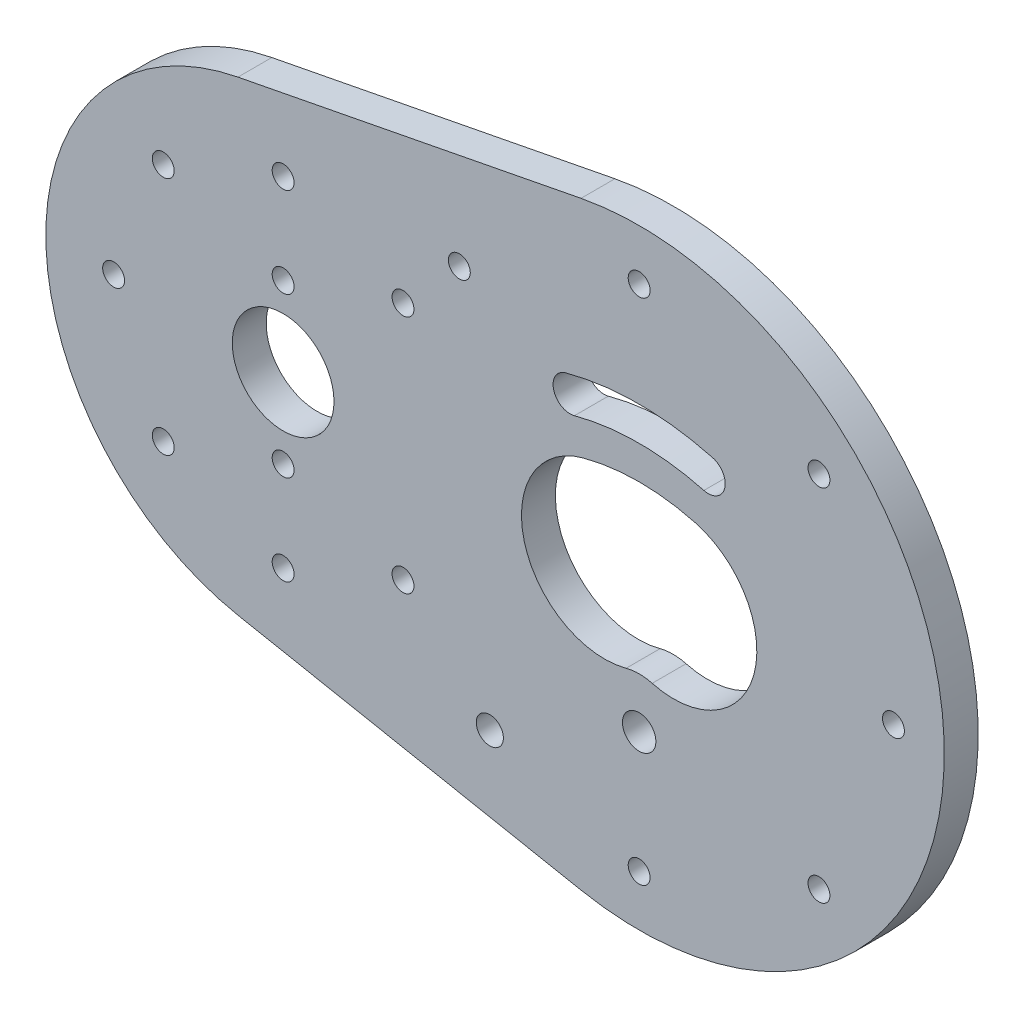
from build123d import *

# Parameters (mm, degrees)
SKETCH1_W                    = 127
SKETCH1_H                    = 88.9
SKETCH1_R                    = 1.564880276
SKETCH1_R_2                  = 4.7625
BOSS_EXTRUDE1_DEPTH          = 3.175
SKETCH2_W                    = 177.519600035
SKETCH2_H                    = 126.718171086
CUT_EXTRUDE1_DEPTH           = 108.848817398
SKETCH4_R                    = 0.635
SKETCH4_R_2                  = 1.27
CUT_EXTRUDE2_DEPTH           = 70.169557294
SKETCH5_R                    = 0.635
CUT_EXTRUDE3_DEPTH           = 70.169557294
M2_5X0_45_TAPPED_HOLE2_D     = 2.05
M2_5X0_45_TAPPED_HOLE2_DEPTH = 7.366
M2_5X0_45_TAPPED_HOLE2_TIP   = 0.615882135


with BuildPart() as part:
    # Sketch1 → Boss-Extrude1 (new body)
    with BuildSketch(Plane.XY):
        with Locations((-28.03132955, 12.5)):
            Rectangle(SKETCH1_W, SKETCH1_H)
        Circle(SKETCH1_R, mode=Mode.SUBTRACT)
        with Locations((-33.3375, 12.5)):
            Circle(SKETCH1_R_2, mode=Mode.SUBTRACT)
        with BuildLine():
            ThreePointArc((5.250170212, 19.593901979), (10.755067214, 10.059140681), (1.220305916, 4.554243678))
            ThreePointArc((1.220305916, 4.554243678), (0, 4.7149), (-1.220305916, 4.554243678))
            ThreePointArc((-1.220305916, 4.554243678), (-10.755067214, 10.059140681), (-5.250170212, 19.593901979))
            ThreePointArc((-5.250170212, 19.593901979), (0, 20.2851), (5.250170212, 19.593901979))
        make_face(mode=Mode.SUBTRACT)
        with BuildLine():
            ThreePointArc((6.881351362, 25.681552906), (0, 26.5875), (-6.881351362, 25.681552906))
            ThreePointArc((-6.881351362, 25.681552906), (-8.003883377, 23.737270423), (-6.059600893, 22.614738408))
            ThreePointArc((-6.059600893, 22.614738408), (0, 23.4125), (6.059600893, 22.614738408))
            ThreePointArc((6.059600893, 22.614738408), (8.003883377, 23.737270423), (6.881351362, 25.681552906))
        make_face(mode=Mode.SUBTRACT)
    extrude(amount=BOSS_EXTRUDE1_DEPTH)

    # Sketch2 → Cut-Extrude1 (cut, through all)
    with BuildSketch(Plane.XY.offset(3.175)):
        with Locations((-18.257651528, 17.008273159)):
            Rectangle(SKETCH2_W, SKETCH2_H)
        with BuildLine():
            Line((-37.570833333, 34.318100602), (-5.442857143, 40.551843631))
            ThreePointArc((-5.442857143, 40.551843631), (28.575, 12.5), (-5.442857143, -15.551843631))
            Line((-5.442857143, -15.551843631), (-37.570833333, -9.318100602))
            ThreePointArc((-37.570833333, -9.318100602), (-55.5625, 12.5), (-37.570833333, 34.318100602))
        make_face(mode=Mode.SUBTRACT)
    extrude(amount=-CUT_EXTRUDE1_DEPTH, mode=Mode.SUBTRACT)

    # Sketch4 → Cut-Extrude2 (cut, through all)
    with BuildSketch(Plane.XY.offset(3.175)):
        with Locations((-33.3375, 28.375)):
            Circle(SKETCH4_R)
        with Locations((0, 36.3125)):
            Circle(SKETCH4_R)
        with Locations((-22.112179849, 23.725320151)):
            Circle(SKETCH4_R)
        with Locations((-13.982083803, -6.855416197)):
            Circle(SKETCH4_R_2)
        with Locations((-22.112179849, 1.274679849)):
            Circle(SKETCH4_R)
        with Locations((-33.3375, -3.375)):
            Circle(SKETCH4_R)
        with Locations((-44.562820151, 1.274679849)):
            Circle(SKETCH4_R)
        with Locations((-49.2125, 12.5)):
            Circle(SKETCH4_R)
        with Locations((16.837980227, 29.337980227)):
            Circle(SKETCH4_R)
        with Locations((23.8125, 12.5)):
            Circle(SKETCH4_R)
        with Locations((16.837980227, -4.337980227)):
            Circle(SKETCH4_R)
        with Locations((0, -11.3125)):
            Circle(SKETCH4_R)
        with Locations((-44.562820151, 23.725320151)):
            Circle(SKETCH4_R)
        with Locations((-16.837980227, 29.337980227)):
            Circle(SKETCH4_R)
    extrude(amount=-CUT_EXTRUDE2_DEPTH, mode=Mode.SUBTRACT)

    # Sketch5 → Cut-Extrude3 (cut, through all)
    with BuildSketch(Plane.XY.offset(3.175)):
        with Locations((-33.3375, 19.9422)):
            Circle(SKETCH5_R)
        with Locations((-33.3375, 5.0578)):
            Circle(SKETCH5_R)
    extrude(amount=-CUT_EXTRUDE3_DEPTH, mode=Mode.SUBTRACT)

    # M2.5x0.45 Tapped Hole2
    with Locations(Plane(origin=(-44.562820151, 23.725320151, 3.175), x_dir=(1, 0, 0), z_dir=(0, 0, 1))):
        with Locations((0, 0), (-4.649679849, -11.225320151), (0, -22.450640302), (11.225320151, -27.100320151), (22.450640302, -22.450640302), (22.450640302, 0), (11.225320151, 4.649679849), (27.724839924, 5.612660076), (61.400800378, 5.612660076), (68.375320151, -11.225320151), (61.400800378, -28.063300378), (44.562820151, -35.037820151), (44.562820151, 12.587179849), (11.225320151, -3.783120151), (11.225320151, -18.667520151)):
            Hole(M2_5X0_45_TAPPED_HOLE2_D / 2, depth=M2_5X0_45_TAPPED_HOLE2_DEPTH)
            with Locations((0, 0, -(M2_5X0_45_TAPPED_HOLE2_DEPTH + M2_5X0_45_TAPPED_HOLE2_TIP / 2))):  # 118° drill point
                Cone(0, M2_5X0_45_TAPPED_HOLE2_D / 2, M2_5X0_45_TAPPED_HOLE2_TIP, mode=Mode.SUBTRACT)


solid = part.part
